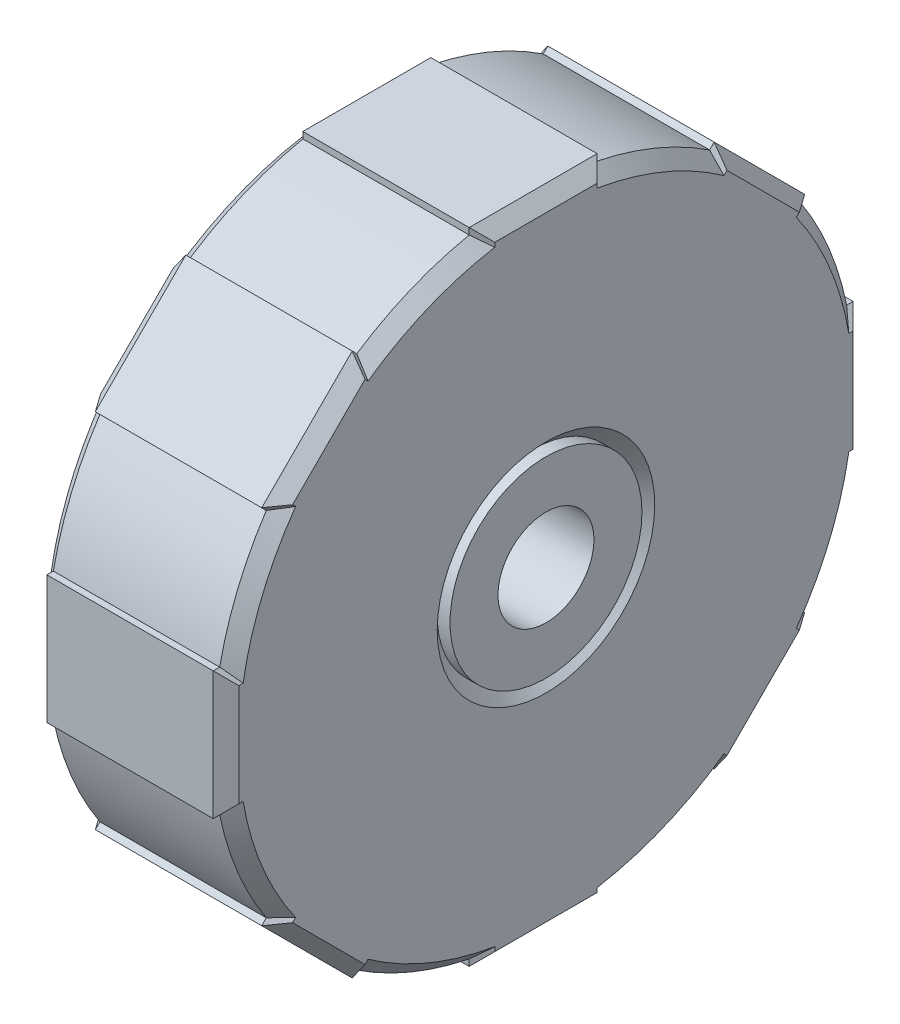
from build123d import *

# Parameters (mm, degrees)
SKETCH1_R                 = 5
SKETCH1_R_2               = 1.5
BOSS_EXTRUDE1_DEPTH       = 3
SKETCH2_W                 = 0.580440463
SKETCH2_H                 = 2
SKETCH2_W_2               = 2
SKETCH2_H_2               = 0.580440463
BOSS_EXTRUDE2_DEPTH       = 3
CHAMFER3_SIZE             = 0.2
CHAMFER4_SIZE             = 0.2
BOSS_EXTRUDE3_OUTLINE_R   = 1.5
BOSS_EXTRUDE3_OUTLINE_R_2 = 0.75
BOSS_EXTRUDE3_DEPTH       = 3


# Read off the part's stored shape, not the designer's step: Boss-Extrude3
with BuildPart() as part:
    # Sketch1 → Boss-Extrude1 (new body)
    with BuildSketch(Plane(origin=(0, 0, 0), x_dir=(0, 0, -1), z_dir=(1, 0, 0))):
        Circle(SKETCH1_R)
        Circle(SKETCH1_R_2, mode=Mode.SUBTRACT)
    extrude(amount=BOSS_EXTRUDE1_DEPTH)

    # Sketch2 → Boss-Extrude2 (add)
    with BuildSketch(Plane(origin=(3, 0, 0), x_dir=(0, 0, -1), z_dir=(1, 0, 0))):
        with Locations((4.709779769, 0)):
            Rectangle(SKETCH2_W, SKETCH2_H)
        Polygon((4.242640687, -2.828427125), (2.828427125, -4.242640687), (2.417993737, -3.8322073), (3.8322073, -2.417993737), align=None)
        with Locations((0, -4.709779769)):
            Rectangle(SKETCH2_W_2, SKETCH2_H_2)
        Polygon((-2.828427125, -4.242640687), (-4.242640687, -2.828427125), (-3.8322073, -2.417993737), (-2.417993737, -3.8322073), align=None)
        with Locations((-4.709779769, 0)):
            Rectangle(SKETCH2_W, SKETCH2_H)
        Polygon((-4.242640687, 2.828427125), (-2.828427125, 4.242640687), (-2.417993737, 3.8322073), (-3.8322073, 2.417993737), align=None)
        with Locations((0, 4.709779769)):
            Rectangle(SKETCH2_W_2, SKETCH2_H_2)
        Polygon((2.828427125, 4.242640687), (4.242640687, 2.828427125), (3.8322073, 2.417993737), (2.417993737, 3.8322073), align=None)
    extrude(amount=-BOSS_EXTRUDE2_DEPTH)

    # Chamfer3
    chamfer3_edges = [part.edges().sort_by_distance(p)[0] for p in [
        (3, 0, 5),
        (3, 1, 4.949489743),
        (3, -1, 4.949489743),
        (3, 1.913417162, 4.619397663),
        (3, 2.792710979, 4.206924542),
        (3, 3.535533906, 3.535533906),
        (3, 4.206924542, 2.792710979),
        (3, 4.619397663, 1.913417162),
        (3, 4.949489743, 1),
        (3, 5, 0),
        (3, 4.949489743, -1),
        (3, 4.619397663, -1.913417162),
        (3, 1, -4.949489743),
        (3, 0, -5),
        (3, 4.206924542, -2.792710979),
        (3, 3.535533906, -3.535533906),
        (3, 2.792710979, -4.206924542),
        (3, -1, -4.949489743),
        (3, -1.913417162, -4.619397663),
        (3, -2.792710979, -4.206924542),
        (3, -3.535533906, -3.535533906),
        (3, -4.206924542, -2.792710979),
        (3, 0, 1.5),
        (3, -4.619397663, -1.913417162),
        (3, -4.949489743, -1),
        (3, -5, 0),
        (3, -4.949489743, 1),
        (3, -4.619397663, 1.913417162),
        (3, -4.206924542, 2.792710979),
        (3, -3.535533906, 3.535533906),
        (3, -2.792710979, 4.206924542),
        (3, 1.913417162, -4.619397663),
        (3, -1.913417162, 4.619397663),
    ]]
    chamfer(chamfer3_edges, length=CHAMFER3_SIZE)

    # Chamfer4
    chamfer4_edges = [part.edges().sort_by_distance(p)[0] for p in [
        (0, -1, 4.949489743),
        (0, 0, 5),
        (0, 1, 4.949489743),
        (0, 1.913417162, -4.619397663),
        (0, 1.913417162, 4.619397663),
        (0, 2.792710979, 4.206924542),
        (0, 3.535533906, 3.535533906),
        (0, 4.206924542, 2.792710979),
        (0, 4.619397663, 1.913417162),
        (0, 1, -4.949489743),
        (0, 4.949489743, 1),
        (0, 5, 0),
        (0, 4.949489743, -1),
        (0, 0, -5),
        (0, -1, -4.949489743),
        (0, 4.619397663, -1.913417162),
        (0, 4.206924542, -2.792710979),
        (0, 3.535533906, -3.535533906),
        (0, 2.792710979, -4.206924542),
        (0, -1.913417162, -4.619397663),
        (0, -2.792710979, -4.206924542),
        (0, -3.535533906, -3.535533906),
        (0, -4.206924542, -2.792710979),
        (0, 0, 1.5),
        (0, -4.619397663, -1.913417162),
        (0, -4.949489743, -1),
        (0, -5, 0),
        (0, -4.949489743, 1),
        (0, -4.619397663, 1.913417162),
        (0, -4.206924542, 2.792710979),
        (0, -3.535533906, 3.535533906),
        (0, -2.792710979, 4.206924542),
        (0, -1.913417162, 4.619397663),
    ]]
    chamfer(chamfer4_edges, length=CHAMFER4_SIZE)

    # Boss-Extrude3 outline → Boss-Extrude3 (add)
    with BuildSketch(Plane.YZ):
        Circle(BOSS_EXTRUDE3_OUTLINE_R)
        Circle(BOSS_EXTRUDE3_OUTLINE_R_2, mode=Mode.SUBTRACT)
    extrude(amount=BOSS_EXTRUDE3_DEPTH)


solid = part.part
